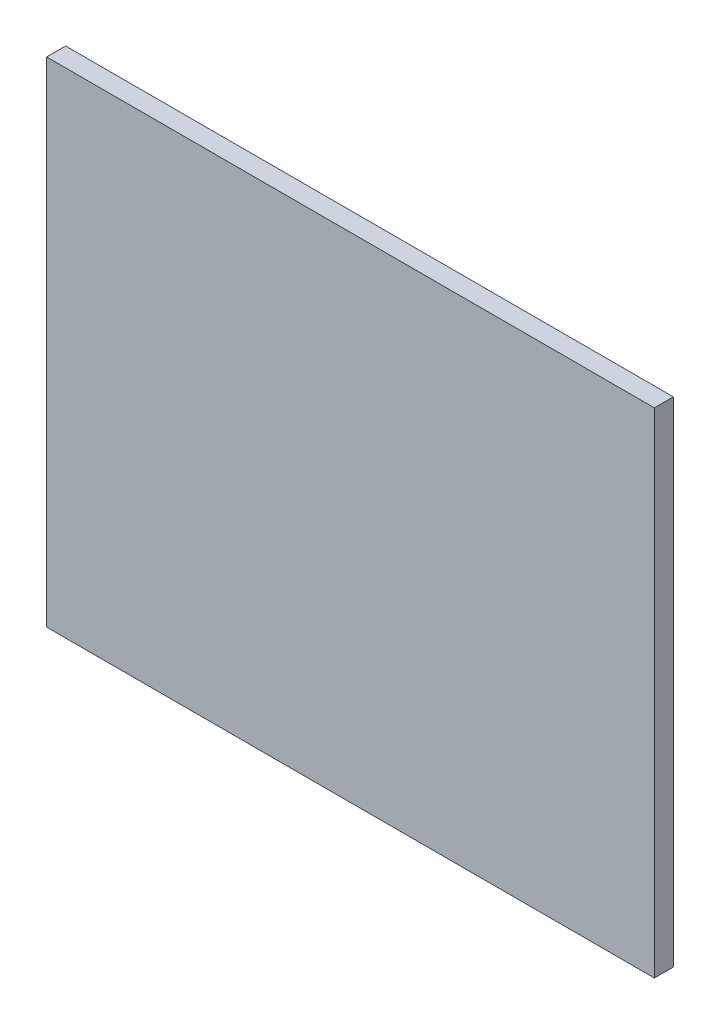
from build123d import *

# Parameters (mm, degrees)
SKETCH1_W           = 203.2
SKETCH1_H           = 165.1
BOSS_EXTRUDE1_DEPTH = 6.35


with BuildPart() as part:
    # Sketch1 → Boss-Extrude1 (new body)
    with BuildSketch(Plane.XY):
        with Locations((101.6, 82.55)):
            Rectangle(SKETCH1_W, SKETCH1_H)
    extrude(amount=BOSS_EXTRUDE1_DEPTH)


solid = part.part
